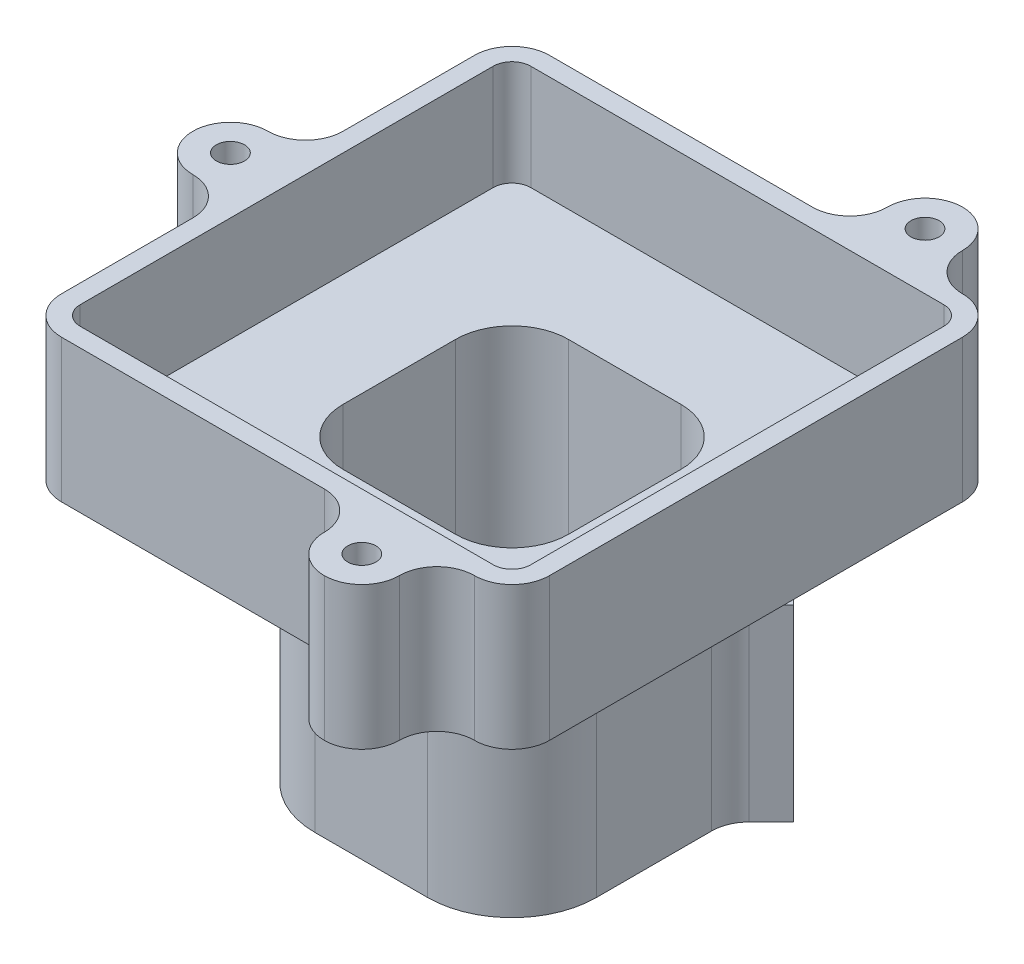
from build123d import *

# Parameters (mm, degrees)
SKETCH1_W                     = 7.5
SKETCH1_H                     = 7.5
BOSS_EXTRUDE1_DEPTH           = 7
SKETCH2_W                     = 13
SKETCH2_H                     = 13
BOSS_EXTRUDE2_DEPTH           = 3.8
SKETCH3_W                     = 6
SKETCH3_H                     = 6
CUT_EXTRUDE1_DEPTH            = 15.182383439
SKETCH6_W                     = 12
SKETCH6_H                     = 12
CUT_EXTRUDE3_DEPTH            = 2.8
FILLET1_R                     = 0.5
BOSS_EXTRUDE3_REACH           = 16.182
FILLET4_R                     = 1.5
FILLET2_R                     = 1
TAP_DRILL_FOR_0_80_TAP1_D     = 1.19126
TAP_DRILL_FOR_0_80_TAP1_DEPTH = 7.11
TAP_DRILL_FOR_0_80_TAP1_TIP   = 0.357890611
FILLET5_R                     = 2.25
SKETCH16_W                    = 2.5
SKETCH16_H                    = 2
CUT_EXTRUDE4_DEPTH            = 0.835786
FILLET6_R                     = 1
SKETCH17_W                    = 2
SKETCH17_H                    = 2
SKETCH17_R                    = 0.375
BOSS_EXTRUDE4_DEPTH           = 3.8
FILLET7_R                     = 1


with BuildPart() as part:
    # Sketch1 → Boss-Extrude1 (new body)
    with BuildSketch(Plane(origin=(0, 0, 0), x_dir=(1, 0, 0), z_dir=(0, 1, 0))):
        Rectangle(SKETCH1_W, SKETCH1_H)
    extrude(amount=BOSS_EXTRUDE1_DEPTH)

    # Sketch2 → Boss-Extrude2 (add)
    with BuildSketch(Plane(origin=(0, 7, 0), x_dir=(1, 0, 0), z_dir=(0, 1, 0))):
        Rectangle(SKETCH2_W, SKETCH2_H)
    extrude(amount=BOSS_EXTRUDE2_DEPTH)

    # Sketch3 → Cut-Extrude1 (cut, through all)
    with BuildSketch(Plane.XZ):
        Rectangle(SKETCH3_W, SKETCH3_H)
    extrude(amount=-CUT_EXTRUDE1_DEPTH, mode=Mode.SUBTRACT)

    # Sketch6 → Cut-Extrude3 (cut)
    with BuildSketch(Plane(origin=(0, 10.8, 0), x_dir=(1, 0, 0), z_dir=(0, 1, 0))):
        Rectangle(SKETCH6_W, SKETCH6_H)
    extrude(amount=-CUT_EXTRUDE3_DEPTH, mode=Mode.SUBTRACT)

    # Fillet1
    fillet1_edges = [part.edges().sort_by_distance(p)[0] for p in [
        (6, 9.4, 6),
        (6, 9.4, -6),
        (-6, 9.4, -6),
        (-6, 9.4, 6),
    ]]
    fillet(fillet1_edges, radius=FILLET1_R)

    # Sketch12 → Boss-Extrude3 (add, up to next)
    with BuildSketch(Plane.XZ, mode=Mode.PRIVATE) as boss_extrude3_sk1:
        Polygon((3.75, -3.75), (4.633883476, -2.866116524), (3.75, -1.982233047), align=None)
    boss_extrude3_tool1 = extrude(boss_extrude3_sk1.sketch, amount=-BOSS_EXTRUDE3_REACH, mode=Mode.PRIVATE) - part.part
    # Sketch12 → Boss-Extrude3 (add, up to next)
    with BuildSketch(Plane.XZ, mode=Mode.PRIVATE) as boss_extrude3_sk2:
        Polygon((2.866116524, -4.633883476), (3.75, -3.75), (1.982233047, -3.75), align=None)
    boss_extrude3_tool2 = extrude(boss_extrude3_sk2.sketch, amount=-BOSS_EXTRUDE3_REACH, mode=Mode.PRIVATE) - part.part
    add(boss_extrude3_tool1.solids().sort_by_distance((4.044628, 0, -2.866117))[0])
    add(boss_extrude3_tool2.solids().sort_by_distance((2.866117, 0, -4.044628))[0])

    # Fillet4
    fillet4_edges = [part.edges().sort_by_distance(p)[0] for p in [
        (-3, 4, 3),
        (3, 4, 3),
        (-3, 4, -3),
        (3, 4, -3),
    ]]
    fillet(fillet4_edges, radius=FILLET4_R)

    # Fillet2
    fillet2_edges = [part.edges().sort_by_distance(p)[0] for p in [
        (3.75, 3.5, -1.982233047),
        (1.982233047, 3.5, -3.75),
    ]]
    fillet(fillet2_edges, radius=FILLET2_R)

    # Tap Drill for #0-80 Tap1
    with Locations(Plane(origin=(3.75, 0, -3.75), x_dir=(-0.7071067811865475, 0, -0.7071067811865477), z_dir=(0.7071067811865477, 0, -0.7071067811865475))):
        with Locations((0, 1.25), (0, 3.75)):
            Hole(TAP_DRILL_FOR_0_80_TAP1_D / 2, depth=TAP_DRILL_FOR_0_80_TAP1_DEPTH)
            with Locations((0, 0, -(TAP_DRILL_FOR_0_80_TAP1_DEPTH + TAP_DRILL_FOR_0_80_TAP1_TIP / 2))):  # 118° drill point
                Cone(0, TAP_DRILL_FOR_0_80_TAP1_D / 2, TAP_DRILL_FOR_0_80_TAP1_TIP, mode=Mode.SUBTRACT)

    # Fillet5
    fillet5_edges = [part.edges().sort_by_distance(p)[0] for p in [
        (3.75, 3.5, 3.75),
        (-3.75, 3.5, 3.75),
        (-3.75, 3.5, -3.75),
    ]]
    fillet(fillet5_edges, radius=FILLET5_R)

    # Sketch16 → Cut-Extrude4 (cut)
    with BuildSketch(Plane(origin=(3.75, 0, -3.75), x_dir=(-0.7071067811865474, 0, -0.7071067811865477), z_dir=(0.7071067811865477, 0, -0.7071067811865474))):
        with Locations((0, 6)):
            Rectangle(SKETCH16_W, SKETCH16_H)
    extrude(amount=-CUT_EXTRUDE4_DEPTH, mode=Mode.SUBTRACT)

    # Fillet6
    fillet6_edges = [part.edges().sort_by_distance(p)[0] for p in [
        (-6.5, 8.9, -6.5),
        (-6.5, 8.9, 6.5),
        (6.5, 8.9, 6.5),
        (6.5, 8.9, -6.5),
    ]]
    fillet(fillet6_edges, radius=FILLET6_R)

    # Sketch17 → Boss-Extrude4 (add)
    # profile 1 of 3: a face of its own
    with BuildSketch(Plane(origin=(0, 10.8, 0), x_dir=(1, 0, 0), z_dir=(0, 1, 0))):
        with Locations((-7.5, 0)):
            Rectangle(SKETCH17_W, SKETCH17_H)
        with Locations(Location((-7.5, 0, 0), (0, 0, 270))):
            Circle(SKETCH17_R, mode=Mode.SUBTRACT)
    # profile 2 of 3: a face of its own
    with BuildSketch(Plane(origin=(0, 10.8, 0), x_dir=(1, 0, 0), z_dir=(0, 1, 0))):
        with Locations((3.5, -7.5)):
            Rectangle(SKETCH17_W, SKETCH17_H)
        with Locations(Location((3.5, -7.5, 0), (0, 0, 270))):
            Circle(SKETCH17_R, mode=Mode.SUBTRACT)
    # profile 3 of 3: a face of its own
    with BuildSketch(Plane(origin=(0, 10.8, 0), x_dir=(1, 0, 0), z_dir=(0, 1, 0))):
        with Locations((3.5, 7.5)):
            Rectangle(SKETCH17_W, SKETCH17_H)
        with Locations(Location((3.5, 7.5, 0), (0, 0, 90))):
            Circle(SKETCH17_R, mode=Mode.SUBTRACT)
    extrude(amount=-BOSS_EXTRUDE4_DEPTH)

    # Fillet7
    fillet7_edges = [part.edges().sort_by_distance(p)[0] for p in [
        (-6.5, 8.9, 1),
        (-8.5, 8.9, 1),
        (-8.5, 8.9, -1),
        (-6.5, 8.9, -1),
        (2.5, 8.9, -6.5),
        (2.5, 8.9, -8.5),
        (4.5, 8.9, -8.5),
        (4.5, 8.9, -6.5),
        (2.5, 8.9, 6.5),
        (2.5, 8.9, 8.5),
        (4.5, 8.9, 8.5),
        (4.5, 8.9, 6.5),
    ]]
    fillet(fillet7_edges, radius=FILLET7_R - 0.0001)  # a hair under: the kernel refuses the full size


solid = part.part
